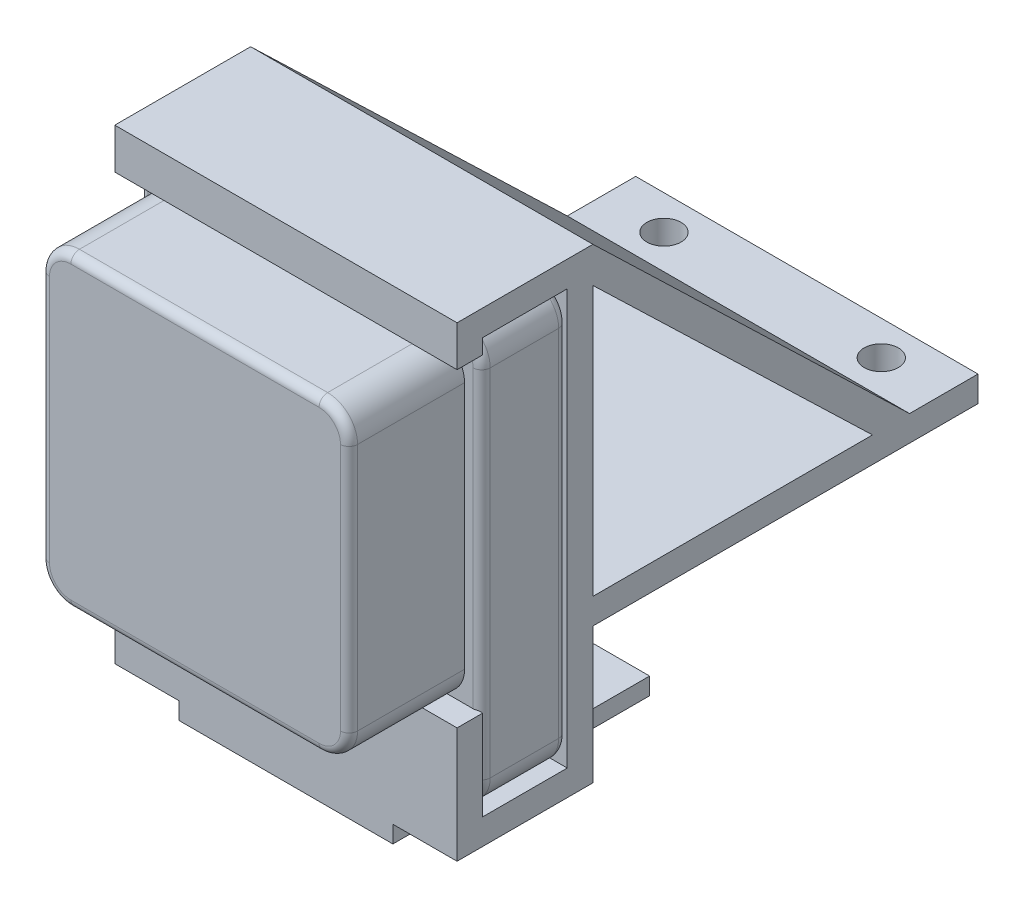
from build123d import *

# Parameters (mm, degrees)
SKETCH1_W                       = 36
SKETCH1_H                       = 36
BOSS_EXTRUDE1_DEPTH             = 13.5
SKETCH1_3_W                     = 40
SKETCH1_3_H                     = 48.5
BOSS_EXTRUDE2_DEPTH             = 10
FILLET1_R                       = 3.5
FILLET2_R                       = 3.5
FILLET3_R                       = 1
FILLET4_R                       = 1
FILLET5_R                       = 1
BOSS_EXTRUDE3_REACH             = 39.343
BOSS_EXTRUDE3_DIRECTION_2_REACH = 39.343
BOSS_EXTRUDE4_REACH             = 41.68
BOSS_EXTRUDE4_DIRECTION_2_REACH = 41.68
BOSS_EXTRUDE5_DEPTH             = 12.5
SKETCH9_R                       = 2
CUT_EXTRUDE3_DEPTH              = 71.944630699


with BuildPart() as part:
    # Sketch1 → Boss-Extrude1 (new body)
    with BuildSketch(Plane.XY):
        Rectangle(SKETCH1_W, SKETCH1_H)
    extrude(amount=BOSS_EXTRUDE1_DEPTH)

    # Fillet2
    fillet2_edges = [part.edges().sort_by_distance(p)[0] for p in [
        (18, 18, 6.75),
        (18, -18, 6.75),
        (-18, -18, 6.75),
        (-18, 18, 6.75),
    ]]
    fillet(fillet2_edges, radius=FILLET2_R)

    # Fillet5
    fillet5_edges = [part.edges().sort_by_distance(p)[0] for p in [
        (-16.974873734, 16.974873734, 13.5),
        (0, 18, 13.5),
        (16.974873734, 16.974873734, 13.5),
        (18, 0, 13.5),
        (16.974873734, -16.974873734, 13.5),
        (0, -18, 13.5),
        (-16.974873734, -16.974873734, 13.5),
        (-18, 0, 13.5),
    ]]
    fillet(fillet5_edges, radius=FILLET5_R)


with BuildPart() as body_2:
    # Sketch1<3> → Boss-Extrude2 (new body)
    with BuildSketch(Plane.XY):
        with Locations((0, -4.25)):
            Rectangle(SKETCH1_3_W, SKETCH1_3_H)
    extrude(amount=-BOSS_EXTRUDE2_DEPTH)

    # Fillet1
    fillet1_edges = [body_2.edges().sort_by_distance(p)[0] for p in [
        (20, 20, -5),
        (-20, -28.5, -5),
        (20, -28.5, -5),
        (-20, 20, -5),
    ]]
    fillet(fillet1_edges, radius=FILLET1_R)

    # Fillet3
    fillet3_edges = [body_2.edges().sort_by_distance(p)[0] for p in [
        (-18.974873734, 18.974873734, 0),
        (0, 20, 0),
        (18.974873734, 18.974873734, 0),
        (20, -4.25, 0),
        (18.974873734, -27.474873734, 0),
        (0, -28.5, 0),
        (-18.974873734, -27.474873734, 0),
        (-20, -4.25, 0),
    ]]
    fillet(fillet3_edges, radius=FILLET3_R)

    # Fillet4
    fillet4_edges = [body_2.edges().sort_by_distance(p)[0] for p in [
        (-18.974873734, 18.974873734, -10),
        (-20, -4.25, -10),
        (-18.974873734, -27.474873734, -10),
        (0, -28.5, -10),
        (18.974873734, -27.474873734, -10),
        (20, -4.25, -10),
        (18.974873734, 18.974873734, -10),
        (0, 20, -10),
    ]]
    fillet(fillet4_edges, radius=FILLET4_R)


with BuildPart() as body_3:

    # Boss-Extrude3: up to this face of the body (flat: up to its plane)
    boss_extrude3_end = Plane(body_2.part.faces().sort_by_distance((20, -4.25, -5))[0])
    # Sketch2 → Boss-Extrude3 (new, up to the picked face)
    with BuildSketch(Plane(origin=(0, 0, 0), x_dir=(0, 0, -1), z_dir=(1, 0, 0)), mode=Mode.PRIVATE) as boss_extrude3_sk1:
        Polygon((-2.875, -18), (-2.875, -31.5), (13, -31.5), (13, 20), (13, 23), (-2.875, 23), (-2.875, 18.25), (0.125, 18.25), (0.125, 20), (10, 20), (10, -28.5), (0.125, -28.5), (0.125, -18), align=None)
    boss_extrude3_tool1 = split(extrude(boss_extrude3_sk1.sketch, amount=BOSS_EXTRUDE3_REACH, mode=Mode.PRIVATE), bisect_by=boss_extrude3_end, keep=Keep.BOTH, mode=Mode.PRIVATE)
    add(boss_extrude3_tool1.solids().sort_by(Axis((0, -24.75, 2.30735), (1, 0, 0)))[0])


    # Boss-Extrude3 direction 2: up to this face of the body (flat: up to its plane)
    boss_extrude3_direction_2_end = Plane(body_2.part.faces().sort_by_distance((-20, -4.25, -5))[0])
    # Sketch2 → Boss-Extrude3 direction 2 (add, up to the picked face)
    with BuildSketch(Plane(origin=(0, 0, 0), x_dir=(0, 0, -1), z_dir=(1, 0, 0)), mode=Mode.PRIVATE) as boss_extrude3_direction_2_sk1:
        Polygon((-2.875, -18), (-2.875, -31.5), (13, -31.5), (13, 20), (13, 23), (-2.875, 23), (-2.875, 18.25), (0.125, 18.25), (0.125, 20), (10, 20), (10, -28.5), (0.125, -28.5), (0.125, -18), align=None)
    boss_extrude3_direction_2_tool1 = split(extrude(boss_extrude3_direction_2_sk1.sketch, amount=-BOSS_EXTRUDE3_DIRECTION_2_REACH, mode=Mode.PRIVATE), bisect_by=boss_extrude3_direction_2_end, keep=Keep.BOTH, mode=Mode.PRIVATE)
    add(boss_extrude3_direction_2_tool1.solids().sort_by(Axis((0, -24.75, 2.30735), (-1, 0, 0)))[0])


    # Boss-Extrude4: up to this face of the body (flat: up to its plane)
    boss_extrude4_end = Plane(body_2.part.faces().sort_by_distance((20, -4.25, -5))[0])
    # Sketch3 → Boss-Extrude4 (add, up to the picked face)
    with BuildSketch(Plane(origin=(0, 0, 0), x_dir=(0, 0, -1), z_dir=(1, 0, 0)), mode=Mode.PRIVATE) as boss_extrude4_sk1:
        Polygon((58, -15.625), (10, -15.625), (10, 23), (13, 23), (50, -12.625), (58, -12.625), align=None)
        Polygon((13, 18.835445964), (13, -12.625), (45.674708791, -12.625), align=None, mode=Mode.SUBTRACT)
    boss_extrude4_tool1 = split(extrude(boss_extrude4_sk1.sketch, amount=BOSS_EXTRUDE4_REACH, mode=Mode.PRIVATE), bisect_by=boss_extrude4_end, keep=Keep.BOTH, mode=Mode.PRIVATE)
    add(boss_extrude4_tool1.solids().sort_by(Axis((0, -15.008892, -34), (1, 0, 0)))[0])


    # Boss-Extrude4 direction 2: up to this face of the body (flat: up to its plane)
    boss_extrude4_direction_2_end = Plane(body_2.part.faces().sort_by_distance((-20, -4.25, -5))[0])
    # Sketch3 → Boss-Extrude4 direction 2 (add, up to the picked face)
    with BuildSketch(Plane(origin=(0, 0, 0), x_dir=(0, 0, -1), z_dir=(1, 0, 0)), mode=Mode.PRIVATE) as boss_extrude4_direction_2_sk1:
        Polygon((58, -15.625), (10, -15.625), (10, 23), (13, 23), (50, -12.625), (58, -12.625), align=None)
        Polygon((13, 18.835445964), (13, -12.625), (45.674708791, -12.625), align=None, mode=Mode.SUBTRACT)
    boss_extrude4_direction_2_tool1 = split(extrude(boss_extrude4_direction_2_sk1.sketch, amount=-BOSS_EXTRUDE4_DIRECTION_2_REACH, mode=Mode.PRIVATE), bisect_by=boss_extrude4_direction_2_end, keep=Keep.BOTH, mode=Mode.PRIVATE)
    add(boss_extrude4_direction_2_tool1.solids().sort_by(Axis((0, -15.008892, -34), (-1, 0, 0)))[0])

    # Sketch8 → Boss-Extrude5 (add, symmetric)
    with BuildSketch(Plane(origin=(0, 0, 0), x_dir=(0, 0, -1), z_dir=(1, 0, 0))):
        Polygon((-2.875, -31.5), (-2.875, -33.5), (27.125, -33.5), (27.125, -31.5), (13, -31.5), align=None)
    extrude(amount=BOSS_EXTRUDE5_DEPTH, both=True)

    # Sketch9 → Cut-Extrude3 (cut, through all)
    with BuildSketch(Plane(origin=(0, -12.625, 0), x_dir=(1, 0, 0), z_dir=(0, 1, 0))):
        with Locations((12.7, 54)):
            Circle(SKETCH9_R)
        with Locations((-12.7, 54)):
            Circle(SKETCH9_R)
    extrude(amount=-CUT_EXTRUDE3_DEPTH, mode=Mode.SUBTRACT)


solid = Compound([part.part, body_2.part, body_3.part])
